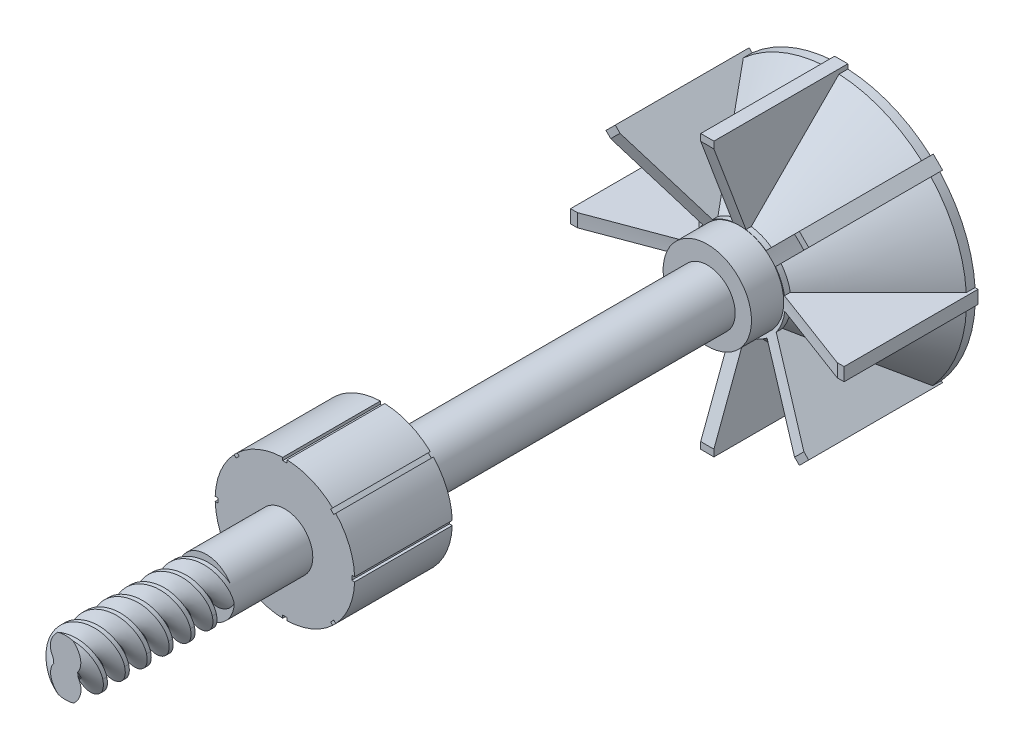
from build123d import *

# Parameters (mm, degrees)
TOOTH_CUT_SWEEP_RH_PD_0_8748IN_PITCH = 4.98602
TOOTH_PATTERN_2_COUNT                = 2
EXTRUDE2_START                       = 79.8875
SKETCH4_R                            = 3.175
EXTRUDE2_DEPTH                       = 79.8875
SKETCH5_W                            = 11.1125
SKETCH5_H                            = 7.9375
SKETCH6_W                            = 0.5
SKETCH6_H                            = 0.507262164
CUT_EXTRUDE1_DEPTH                   = 11.1125
CIRPATTERN1_COUNT                    = 8
EXTRUDE3_REACH                       = 98.924
SKETCH8_W                            = 1.5
SKETCH8_H                            = 15.762244559
CIRPATTERN2_COUNT                    = 8
CHAMFER1_SIZE                        = 0.5
CUT_EXTRUDE2_DEPTH                   = 94.657514453
CUT_EXTRUDE2_DEPTH_BACK              = 94.657514453


with BuildPart() as part:
    # Worm-BaseSketch → 32.0081 Diametral Pitch, Fine Pitch Involute 25 deg (revolve)
    with BuildSketch(Plane(origin=(0, 0, 0), x_dir=(0, 0, -1), z_dir=(1, 0, 0)), mode=Mode.PRIVATE) as f_32_0081_diametral_pitch_fine_pitch_invo_sk:
        Polygon((-11.1125, 0), (11.1125, 0), (11.1125, 3.175), (-11.049004005, 3.175), (-11.1125, 3.111504005), align=None)
    revolve(f_32_0081_diametral_pitch_fine_pitch_invo_sk.sketch.rotate(Axis((0, 0, 22.225), (0, 0, -1)), 90), axis=Axis((0, 0, 22.225), (0, 0, -1)))

    # Tooth-Cut-Sweep RH, PD: 0.8748in: arcs per turn and ends read off the stored shape
    # Tooth-Cut-Sweep RH, PD: 0.8748in: the profile of Tooth-Sketch screwed along a right-hand helix through 5 turns, 6 arcs to a turn; built about Z, then put on its axis
    tooth_cut_sweep_rh_pd_0_8748in_z = Axis((0, 0, 0), (0, 0, 1))
    tooth_cut_sweep_rh_pd_0_8748in_corners = [(3.384309675, 0, 1.120121039), (3.384309675, 0, -1.120121039), (1.533540792, 0, -0.203337268), (1.378190325, 0, 0.046981488), (1.378190325, 0, 0.126383961)]
    with BuildLine(mode=Mode.PRIVATE) as tooth_cut_sweep_rh_pd_0_8748in_profile:
        Line(tooth_cut_sweep_rh_pd_0_8748in_corners[0], tooth_cut_sweep_rh_pd_0_8748in_corners[1])
        Line(tooth_cut_sweep_rh_pd_0_8748in_corners[1], tooth_cut_sweep_rh_pd_0_8748in_corners[2])
        Line(tooth_cut_sweep_rh_pd_0_8748in_corners[3], tooth_cut_sweep_rh_pd_0_8748in_corners[4])
        Line(tooth_cut_sweep_rh_pd_0_8748in_corners[4], tooth_cut_sweep_rh_pd_0_8748in_corners[0])
        ThreePointArc((1.533540792, 0, -0.203337268), (1.420184422, 0, -0.10032198), (1.378190325, 0, 0.046981488))
    tooth_cut_sweep_rh_pd_0_8748in_cap = Face(tooth_cut_sweep_rh_pd_0_8748in_profile.wire())
    tooth_cut_sweep_rh_pd_0_8748in_arcs = [((1.533540792, 0, -0.203337268), (1.378190325, 0, -0.126383961), (1.378190325, 0, 0.046981488), (1, 0.8496702725926034, 1))]  # start, shoulder, end, weights
    tooth_cut_sweep_rh_pd_0_8748in_turn_angles = [0, 30, 60, 90, 120, 150, 180, 210, 240, 270, 300, 330, 360]
    tooth_cut_sweep_rh_pd_0_8748in_turn_weights = [1, 0.8660254037844387, 1, 0.8660254037844387, 1, 0.8660254037844387, 1, 0.8660254037844387, 1, 0.8660254037844387, 1, 0.8660254037844387, 1]
    tooth_cut_sweep_rh_pd_0_8748in_turn_rails = [Edge.make_bspline([Vector(p[0], p[1], 0).rotate(tooth_cut_sweep_rh_pd_0_8748in_z, tooth_cut_sweep_rh_pd_0_8748in_turn_angles[k]) / tooth_cut_sweep_rh_pd_0_8748in_turn_weights[k] + Vector(0, 0, p[2] + TOOTH_CUT_SWEEP_RH_PD_0_8748IN_PITCH * tooth_cut_sweep_rh_pd_0_8748in_turn_angles[k] / 360) for k in range(13)], [0, 0, 0, 1, 1, 2, 2, 3, 3, 4, 4, 5, 5, 6, 6, 6], 2, tooth_cut_sweep_rh_pd_0_8748in_turn_weights) for p in tooth_cut_sweep_rh_pd_0_8748in_corners]
    tooth_cut_sweep_rh_pd_0_8748in_turn_sides = [*[Face.make_surface_from_curves(tooth_cut_sweep_rh_pd_0_8748in_turn_rails[p[0]], tooth_cut_sweep_rh_pd_0_8748in_turn_rails[p[1]]) for p in [(0, 1), (1, 2), (3, 4), (4, 0)]], *[Face.make_bezier_surface([[Vector(p[j][0], p[j][1], 0).rotate(tooth_cut_sweep_rh_pd_0_8748in_z, tooth_cut_sweep_rh_pd_0_8748in_turn_angles[2 * i + k]) / tooth_cut_sweep_rh_pd_0_8748in_turn_weights[2 * i + k] + Vector(0, 0, p[j][2] + TOOTH_CUT_SWEEP_RH_PD_0_8748IN_PITCH * tooth_cut_sweep_rh_pd_0_8748in_turn_angles[2 * i + k] / 360) for k in range(3)] for j in range(3)], [[p[3][j] * tooth_cut_sweep_rh_pd_0_8748in_turn_weights[2 * i + k] for k in range(3)] for j in range(3)]) for p in tooth_cut_sweep_rh_pd_0_8748in_arcs for i in range(6)]]
    tooth_cut_sweep_rh_pd_0_8748in = Plane(origin=(0, 0, 12.359005), x_dir=(1, 0, 0), z_dir=(0, 0, -1)) * Solid(Shell([*[p.moved(Location((0, 0, TOOTH_CUT_SWEEP_RH_PD_0_8748IN_PITCH * i))) for i in range(5) for p in tooth_cut_sweep_rh_pd_0_8748in_turn_sides], tooth_cut_sweep_rh_pd_0_8748in_cap, tooth_cut_sweep_rh_pd_0_8748in_cap.rotate(tooth_cut_sweep_rh_pd_0_8748in_z, 1800).moved(Location((0, 0, TOOTH_CUT_SWEEP_RH_PD_0_8748IN_PITCH * 1800 / 360)))]))
    add(tooth_cut_sweep_rh_pd_0_8748in, mode=Mode.SUBTRACT)

    # Tooth Pattern,  2: Tooth-Cut-Sweep RH, PD: 0.8748in ×2 about axis
    tooth_pattern_2_axis = Axis((0, 0, -88.99), (0, 0, 1))
    for i in range(1, TOOTH_PATTERN_2_COUNT):
        add(tooth_cut_sweep_rh_pd_0_8748in.rotate(tooth_pattern_2_axis, i * 360 / TOOTH_PATTERN_2_COUNT), mode=Mode.SUBTRACT)

    # Sketch4 → Extrude2 (add)
    with BuildSketch(Plane.XY.offset(-91).offset(EXTRUDE2_START)):
        Circle(SKETCH4_R)
    extrude(amount=-EXTRUDE2_DEPTH)

    # Sketch5 → Revolve1 (revolve)
    with BuildSketch(Plane(origin=(0, 0, 0), x_dir=(0, 0, -1), z_dir=(1, 0, 0)), mode=Mode.PRIVATE) as revolve1_sk:
        with Locations((25.617475408, 4.165595109)):
            Rectangle(SKETCH5_W, SKETCH5_H)
    revolve(revolve1_sk.sketch.rotate(Axis((0, 0.196845109, -11.049004005), (0, 0, -1)), 90), axis=Axis((0, 0.196845109, -11.049004005), (0, 0, -1)))

    # Sketch6 → Cut-Extrude1 (cut)
    with BuildSketch(Plane.XY.offset(-20.061225408)):
        with Locations((0, 8.060530243)):
            Rectangle(SKETCH6_W, SKETCH6_H)
    cut_extrude1 = extrude(amount=-CUT_EXTRUDE1_DEPTH, mode=Mode.SUBTRACT)

    # CirPattern1: Cut-Extrude1 ×8 about axis
    cirpattern1_axis = Axis((0, 0.196845109, 0), (0, 0, 1))
    for i in range(1, CIRPATTERN1_COUNT):
        add(cut_extrude1.rotate(cirpattern1_axis, i * 360 / CIRPATTERN1_COUNT), mode=Mode.SUBTRACT)

    # Sketch7 → Revolve2 (revolve)
    with BuildSketch(Plane(origin=(0, 0, 0), x_dir=(0, 0, -1), z_dir=(1, 0, 0)), mode=Mode.PRIVATE) as revolve2_sk:
        Polygon((83.377822821, 0.196845109), (83.377822821, 15.262244559), (82.377822821, 15.262244559), (72.39242337, 5.276845109), (68.137822821, 5.276845109), (68.137822821, 0.196845109), align=None)
    revolve(revolve2_sk.sketch.rotate(Axis((0, 0, 22.225), (0, 0, 1)), 268.578878988), axis=Axis((0, 0, 22.225), (0, 0, 1)))

    # Extrude3: up to this face of the body (flat: up to its plane)
    extrude3_end = Plane(part.part.faces().sort_by_distance((-5.126016221, 0.127167893, -68.137822821))[0])
    # Sketch8 → Extrude3 (add, up to the picked face)
    with BuildSketch(Plane(origin=(0, 0, -83.377822821), x_dir=(-1, 0, 0), z_dir=(0, 0, -1)), mode=Mode.PRIVATE) as extrude3_sk1:
        with Locations((0, 7.88112228)):
            Rectangle(SKETCH8_W, SKETCH8_H)
    extrude3_tool1 = split(extrude(extrude3_sk1.sketch, amount=-EXTRUDE3_REACH, mode=Mode.PRIVATE), bisect_by=extrude3_end, keep=Keep.BOTH, mode=Mode.PRIVATE)
    extrude3 = extrude3_tool1.solids().sort_by(Axis((0, 7.881122, -83.377823), (0, 0, 1)))[0]
    add(extrude3)

    # CirPattern2: Extrude3 ×8 about axis
    cirpattern2_axis = Axis((0, 0.196845109, 0), (0, 0, 1))
    for i in range(1, CIRPATTERN2_COUNT):
        add(extrude3.rotate(cirpattern2_axis, i * 360 / CIRPATTERN2_COUNT))

    # Sketch9 → Cut-Revolve1 (revolve, cut)
    with BuildSketch(Plane(origin=(0, 0, 0), x_dir=(0, 0, -1), z_dir=(1, 0, 0)), mode=Mode.PRIVATE) as cut_revolve1_sk:
        Polygon((71.806888822, 5.223274289), (68.137822821, 15.000854362), (65.630075736, 15.000854362), (65.630075736, 5.223274289), align=None)
    revolve(cut_revolve1_sk.sketch.rotate(Axis((0, 0.196845109, -11.049004005), (0, 0, -1)), 90), axis=Axis((0, 0.196845109, -11.049004005), (0, 0, -1)), mode=Mode.SUBTRACT)

    # Chamfer1
    chamfer1_edges = [part.edges().sort_by_distance(p)[0] for p in [
        (-3.175, 0, -91),
    ]]
    chamfer(chamfer1_edges, length=CHAMFER1_SIZE)

    # Sketch12 → Cut-Extrude2 (cut, two sides: drawn at the far end of the back side and taken through both)
    with BuildSketch(Plane(origin=(0, 0, 0), x_dir=(1, 0, 0), z_dir=(0, 1, 0)).offset(-CUT_EXTRUDE2_DEPTH_BACK)):
        Polygon((-231.663994758, -4.8875), (-17.37897193, -4.8875), (19.629486281, -4.8875), (233.914509108, -4.8875), (233.914509108, -433.457545655), (-231.663994758, -433.457545655), align=None)
    extrude(amount=CUT_EXTRUDE2_DEPTH + CUT_EXTRUDE2_DEPTH_BACK, mode=Mode.SUBTRACT)


solid = part.part
